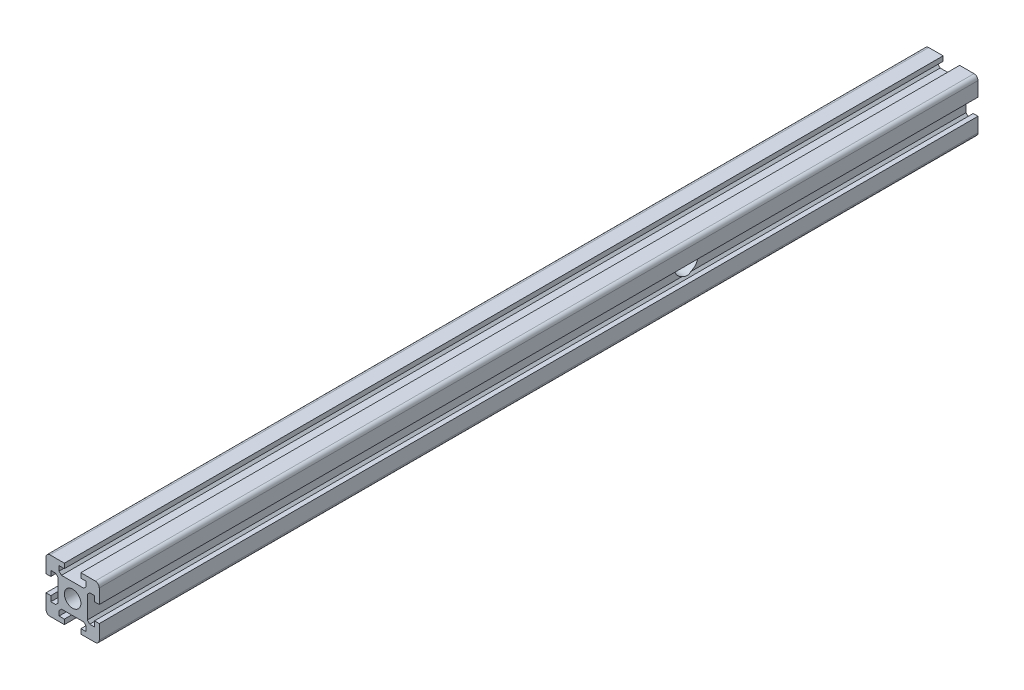
from build123d import *

# Parameters (mm, degrees)
SKETCH1_R               = 3.1
BOSS_EXTRUDE1_DEPTH     = 330
CUT_EXTRUDE2_DEPTH      = 331.514794999
CUT_EXTRUDE2_DEPTH_BACK = 12
SKETCH5_R               = 4.5


with BuildPart() as part:
    # Sketch1 → Boss-Extrude1 (new body)
    with BuildSketch(Plane.XY):
        with BuildLine():
            Line((-10, 3.1), (-8.2, 3.1))
            Line((-8.2, 3.1), (-8.2, 5.1))
            Line((-8.2, 5.1), (-6.4, 5.1))
            Line((-6.4, 5.1), (-5.492892349, 4.192892349))
            Line((-5.492892349, 4.192892349), (-5.492892349, -4.192892349))
            Line((-5.492892349, -4.192892349), (-6.4, -5.1))
            Line((-6.4, -5.1), (-8.2, -5.1))
            Line((-8.2, -5.1), (-8.2, -3.1))
            Line((-8.2, -3.1), (-10, -3.1))
            Line((-10, -3.1), (-10, -8.5))
            ThreePointArc((-10, -8.5), (-9.560660172, -9.560660172), (-8.5, -10))
            Line((-8.5, -10), (-3.1, -10))
            Line((-3.1, -10), (-3.1, -8.2))
            Line((-3.1, -8.2), (-5.1, -8.2))
            Line((-5.1, -8.2), (-5.1, -6.4))
            Line((-5.1, -6.4), (-4.192892349, -5.492892349))
            Line((-4.192892349, -5.492892349), (4.192892349, -5.492892349))
            Line((4.192892349, -5.492892349), (5.1, -6.4))
            Line((5.1, -6.4), (5.1, -8.2))
            Line((5.1, -8.2), (3.1, -8.2))
            Line((3.1, -8.2), (3.1, -10))
            Line((3.1, -10), (8.5, -10))
            ThreePointArc((8.5, -10), (9.560660172, -9.560660172), (10, -8.5))
            Line((10, -8.5), (10, -3.1))
            Line((10, -3.1), (8.2, -3.1))
            Line((8.2, -3.1), (8.2, -5.1))
            Line((8.2, -5.1), (6.4, -5.1))
            Line((6.4, -5.1), (5.492892349, -4.192892349))
            Line((5.492892349, -4.192892349), (5.492892349, 4.192892349))
            Line((5.492892349, 4.192892349), (6.4, 5.1))
            Line((6.4, 5.1), (8.2, 5.1))
            Line((8.2, 5.1), (8.2, 3.1))
            Line((8.2, 3.1), (10, 3.1))
            Line((10, 3.1), (10, 8.5))
            ThreePointArc((10, 8.5), (9.560660172, 9.560660172), (8.5, 10))
            Line((8.5, 10), (3.1, 10))
            Line((3.1, 10), (3.1, 8.2))
            Line((3.1, 8.2), (5.1, 8.2))
            Line((5.1, 8.2), (5.1, 6.4))
            Line((5.1, 6.4), (4.192892349, 5.492892349))
            Line((4.192892349, 5.492892349), (-4.192892349, 5.492892349))
            Line((-4.192892349, 5.492892349), (-5.1, 6.4))
            Line((-5.1, 6.4), (-5.1, 8.2))
            Line((-5.1, 8.2), (-3.1, 8.2))
            Line((-3.1, 8.2), (-3.1, 10))
            Line((-3.1, 10), (-8.5, 10))
            ThreePointArc((-8.5, 10), (-9.560660172, 9.560660172), (-10, 8.5))
            Line((-10, 8.5), (-10, 3.1))
        make_face()
        Circle(SKETCH1_R, mode=Mode.SUBTRACT)
    extrude(amount=BOSS_EXTRUDE1_DEPTH)

    # Sketch5 → Cut-Extrude2 (cut, two sides: drawn at the far end of the back side and taken through both)
    with BuildSketch(Plane(origin=(-5.492892349, 0, 0), x_dir=(0, 0, -1), z_dir=(-1, 0, 0)).offset(-CUT_EXTRUDE2_DEPTH_BACK)):
        with Locations((-105, 0)):
            Circle(SKETCH5_R)
    extrude(amount=CUT_EXTRUDE2_DEPTH + CUT_EXTRUDE2_DEPTH_BACK, mode=Mode.SUBTRACT)


solid = part.part
